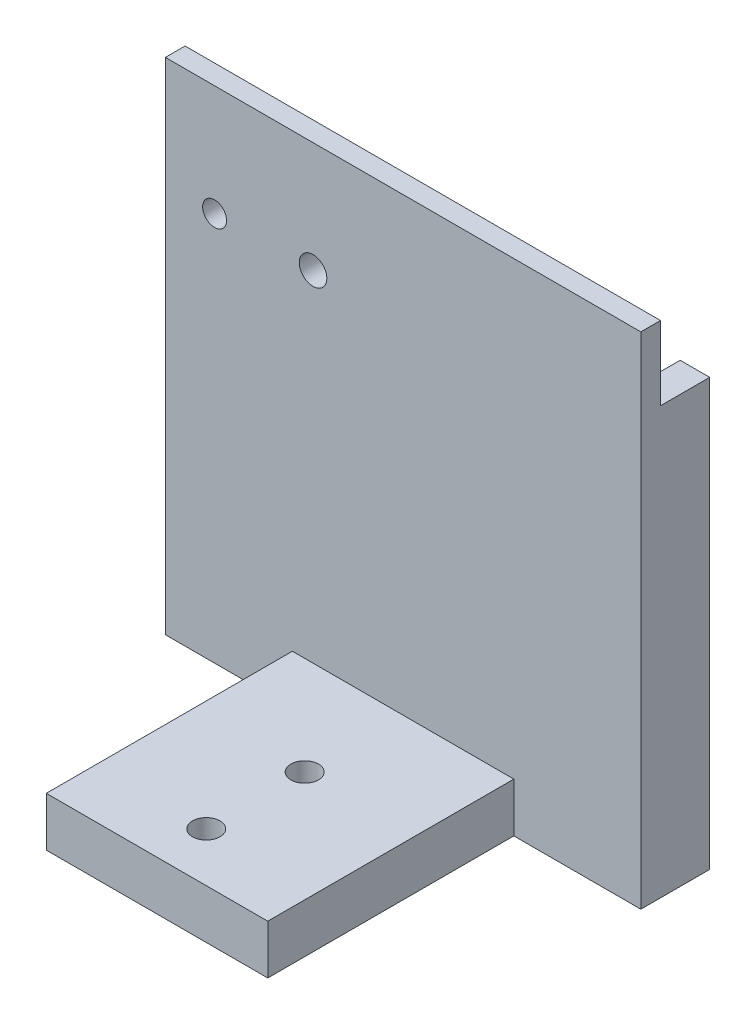
from build123d import *

# Parameters (mm, degrees)
SKETCH1_W           = 48.3
SKETCH1_H           = 43.3
BOSS_EXTRUDE1_DEPTH = 2
BOSS_EXTRUDE2_DEPTH = 5
SKETCH2_W           = 22.5
SKETCH2_H           = 5
BOSS_EXTRUDE3_DEPTH = 25
SKETCH3_W           = 48.3
SKETCH3_H           = 22.5
SKETCH3_R           = 1.214913049
SKETCH3_R_2         = 1.4
BOSS_EXTRUDE4_DEPTH = 2
SKETCH4_R           = 1.4
CUT_EXTRUDE1_DEPTH  = 59.393224566
SKETCH3_2_R         = 1.214913049
SKETCH3_2_R_2       = 1.4
CUT_EXTRUDE2_DEPTH  = 2


with BuildPart() as part:
    # Sketch1 → Boss-Extrude1 (new body)
    with BuildSketch(Plane.XY):
        with Locations((0, -0.5)):
            Rectangle(SKETCH1_W, SKETCH1_H)
    extrude(amount=BOSS_EXTRUDE1_DEPTH)

    # Sketch1<3> → Boss-Extrude2 (add)
    with BuildSketch(Plane.XY):
        Polygon((21.15, 21.15), (21.15, -21.15), (-21.15, -21.15), (-21.15, 21.15), (-24.15, 21.15), (-24.15, -22.15), (24.15, -22.15), (24.15, 21.15), align=None)
    extrude(amount=-BOSS_EXTRUDE2_DEPTH)

    # Sketch2 → Boss-Extrude3 (add)
    with BuildSketch(Plane.XY.offset(2)):
        with Locations((0, -19.65)):
            Rectangle(SKETCH2_W, SKETCH2_H)
    extrude(amount=BOSS_EXTRUDE3_DEPTH)

    # Sketch3 → Boss-Extrude4 (add)
    with BuildSketch(Plane.XY.offset(2)):
        with Locations((0, 17.3989757)):
            Rectangle(SKETCH3_W, SKETCH3_H)
        with Locations((-19.15, 17.3989757)):
            Circle(SKETCH3_R, mode=Mode.SUBTRACT)
        with Locations((-9.15, 17.3989757)):
            Circle(SKETCH3_R_2, mode=Mode.SUBTRACT)
    extrude(amount=-BOSS_EXTRUDE4_DEPTH)

    # Sketch4 → Cut-Extrude1 (cut, through all)
    with BuildSketch(Plane(origin=(0, -17.15, 0), x_dir=(1, 0, 0), z_dir=(0, 1, 0))):
        with Locations((0, -12)):
            Circle(SKETCH4_R)
        with Locations((0, -22)):
            Circle(SKETCH4_R)
    extrude(amount=-CUT_EXTRUDE1_DEPTH, mode=Mode.SUBTRACT)

    # Sketch3<2> → Cut-Extrude2 (cut)
    with BuildSketch(Plane.XY.offset(2)):
        with Locations((-19.15, 17.3989757)):
            Circle(SKETCH3_2_R)
        with Locations((-9.15, 17.3989757)):
            Circle(SKETCH3_2_R_2)
    extrude(amount=-CUT_EXTRUDE2_DEPTH, mode=Mode.SUBTRACT)


solid = part.part
